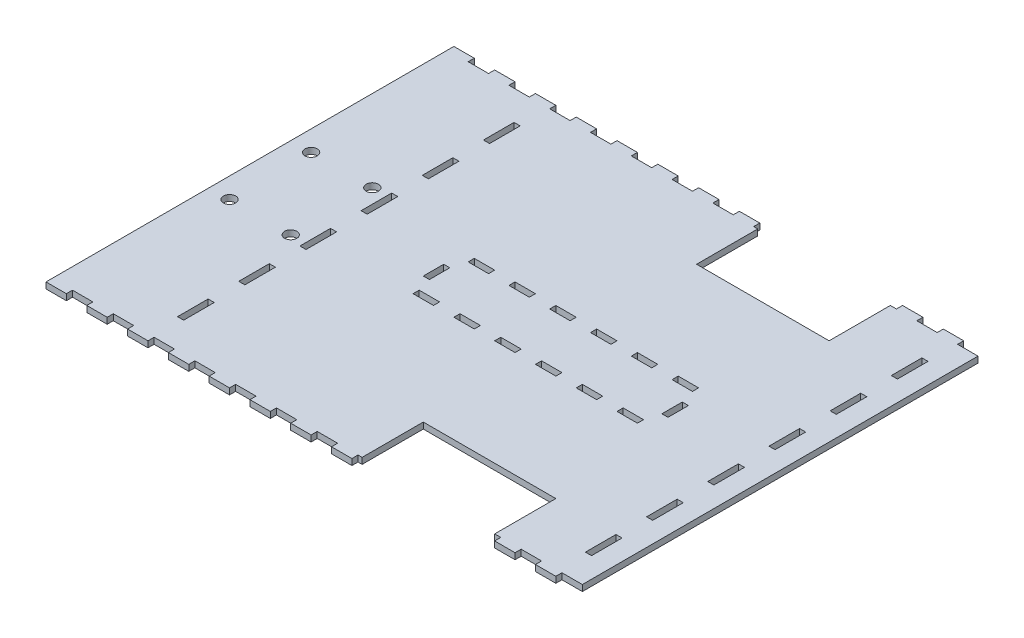
from build123d import *

# Parameters (mm, degrees)
SKETCH3_W           = 3
SKETCH3_H           = 15
SKETCH3_R           = 3
SKETCH3_H_2         = 10
SKETCH3_W_2         = 10
SKETCH3_H_3         = 3
BOSS_EXTRUDE1_DEPTH = 3
SKETCH4_W           = 65
SKETCH4_H           = 30
CUT_EXTRUDE1_DEPTH  = 10


with BuildPart() as part:
    # Sketch3 → Boss-Extrude1 (new body)
    with BuildSketch(Plane(origin=(0, 0, 0), x_dir=(1, 0, 0), z_dir=(0, 1, 0))):
        Polygon((-300, 97), (-300, -97), (-300, -100), (-290, -100), (-290, -97), (-280, -97), (-280, -100), (-270, -100), (-270, -97), (-260, -97), (-260, -100), (-250, -100), (-250, -97), (-240, -97), (-240, -100), (-230, -100), (-230, -97), (-220, -97), (-220, -100), (-210, -100), (-210, -97), (-200, -97), (-200, -100), (-190, -100), (-190, -97), (-180, -97), (-180, -100), (-170, -100), (-170, -97), (-160, -97), (-160, -100), (-150, -100), (-150, -97), (-140, -97), (-140, -100), (-130, -100), (-130, -97), (-120, -97), (-120, -100), (-110, -100), (-110, -97), (-100, -97), (-100, -100), (-90, -100), (-90, -97), (-80, -97), (-80, -100), (-70, -100), (-70, -97), (-60, -97), (-60, -100), (-50, -100), (-50, -97), (-40, -97), (-40, 97), (-50, 97), (-50, 100), (-60, 100), (-60, 97), (-70, 97), (-70, 100), (-80, 100), (-80, 97), (-90, 97), (-90, 100), (-100, 100), (-100, 97), (-110, 97), (-110, 100), (-120, 100), (-120, 97), (-130, 97), (-130, 100), (-140, 100), (-140, 97), (-150, 97), (-150, 100), (-160, 100), (-160, 97), (-170, 97), (-170, 100), (-180, 100), (-180, 97), (-190, 97), (-190, 100), (-200, 100), (-200, 97), (-210, 97), (-210, 100), (-220, 100), (-220, 97), (-230, 97), (-230, 100), (-240, 100), (-240, 97), (-250, 97), (-250, 100), (-260, 100), (-260, 97), (-270, 97), (-270, 100), (-280, 100), (-280, 97), (-290, 97), (-290, 100), (-300, 100), align=None)
        with Locations((-251.5, -75)):
            Rectangle(SKETCH3_W, SKETCH3_H, mode=Mode.SUBTRACT)
        with Locations((-251.5, -45)):
            Rectangle(SKETCH3_W, SKETCH3_H, mode=Mode.SUBTRACT)
        with Locations((-290, -20)):
            Circle(SKETCH3_R, mode=Mode.SUBTRACT)
        with Locations((-260, -20)):
            Circle(SKETCH3_R, mode=Mode.SUBTRACT)
        with Locations((-251.5, -15)):
            Rectangle(SKETCH3_W, SKETCH3_H, mode=Mode.SUBTRACT)
        with Locations((-208.5, 0)):
            Rectangle(SKETCH3_W, SKETCH3_H_2, mode=Mode.SUBTRACT)
        with Locations((-200, -13.5)):
            Rectangle(SKETCH3_W_2, SKETCH3_H_3, mode=Mode.SUBTRACT)
        with Locations((-180, -13.5)):
            Rectangle(SKETCH3_W_2, SKETCH3_H_3, mode=Mode.SUBTRACT)
        with Locations((-51.5, -75)):
            Rectangle(SKETCH3_W, SKETCH3_H, mode=Mode.SUBTRACT)
        with Locations((-160, -13.5)):
            Rectangle(SKETCH3_W_2, SKETCH3_H_3, mode=Mode.SUBTRACT)
        with Locations((-140, -13.5)):
            Rectangle(SKETCH3_W_2, SKETCH3_H_3, mode=Mode.SUBTRACT)
        with Locations((-120, -13.5)):
            Rectangle(SKETCH3_W_2, SKETCH3_H_3, mode=Mode.SUBTRACT)
        with Locations((-51.5, -45)):
            Rectangle(SKETCH3_W, SKETCH3_H, mode=Mode.SUBTRACT)
        with Locations((-100, -13.5)):
            Rectangle(SKETCH3_W_2, SKETCH3_H_3, mode=Mode.SUBTRACT)
        with Locations((-91.5, 0)):
            Rectangle(SKETCH3_W, SKETCH3_H_2, mode=Mode.SUBTRACT)
        with Locations((-51.5, -15)):
            Rectangle(SKETCH3_W, SKETCH3_H, mode=Mode.SUBTRACT)
        with Locations((-290, 20)):
            Circle(SKETCH3_R, mode=Mode.SUBTRACT)
        with Locations((-251.5, 15)):
            Rectangle(SKETCH3_W, SKETCH3_H, mode=Mode.SUBTRACT)
        with Locations((-260, 20)):
            Circle(SKETCH3_R, mode=Mode.SUBTRACT)
        with Locations((-251.5, 45)):
            Rectangle(SKETCH3_W, SKETCH3_H, mode=Mode.SUBTRACT)
        with Locations((-200, 13.5)):
            Rectangle(SKETCH3_W_2, SKETCH3_H_3, mode=Mode.SUBTRACT)
        with Locations((-180, 13.5)):
            Rectangle(SKETCH3_W_2, SKETCH3_H_3, mode=Mode.SUBTRACT)
        with Locations((-251.5, 75)):
            Rectangle(SKETCH3_W, SKETCH3_H, mode=Mode.SUBTRACT)
        with Locations((-160, 13.5)):
            Rectangle(SKETCH3_W_2, SKETCH3_H_3, mode=Mode.SUBTRACT)
        with Locations((-140, 13.5)):
            Rectangle(SKETCH3_W_2, SKETCH3_H_3, mode=Mode.SUBTRACT)
        with Locations((-120, 13.5)):
            Rectangle(SKETCH3_W_2, SKETCH3_H_3, mode=Mode.SUBTRACT)
        with Locations((-100, 13.5)):
            Rectangle(SKETCH3_W_2, SKETCH3_H_3, mode=Mode.SUBTRACT)
        with Locations((-51.5, 15)):
            Rectangle(SKETCH3_W, SKETCH3_H, mode=Mode.SUBTRACT)
        with Locations((-51.5, 45)):
            Rectangle(SKETCH3_W, SKETCH3_H, mode=Mode.SUBTRACT)
        with Locations((-51.5, 75)):
            Rectangle(SKETCH3_W, SKETCH3_H, mode=Mode.SUBTRACT)
    extrude(amount=BOSS_EXTRUDE1_DEPTH)

    # Sketch4 → Cut-Extrude1 (cut)
    with BuildSketch(Plane(origin=(0, 3, 0), x_dir=(1, 0, 0), z_dir=(0, 1, 0))):
        with Locations((-115.5, 82)):
            Rectangle(SKETCH4_W, SKETCH4_H)
        with Locations((-115.5, -82)):
            Rectangle(SKETCH4_W, SKETCH4_H)
    extrude(amount=-CUT_EXTRUDE1_DEPTH, mode=Mode.SUBTRACT)


with BuildPart() as body_2:
    # of the pieces the cut leaves, the one that is kept (cut_extrude1_keep)
    add(part.part.solids().sort_by_distance((-300, 0, -100))[0])


solid = body_2.part
